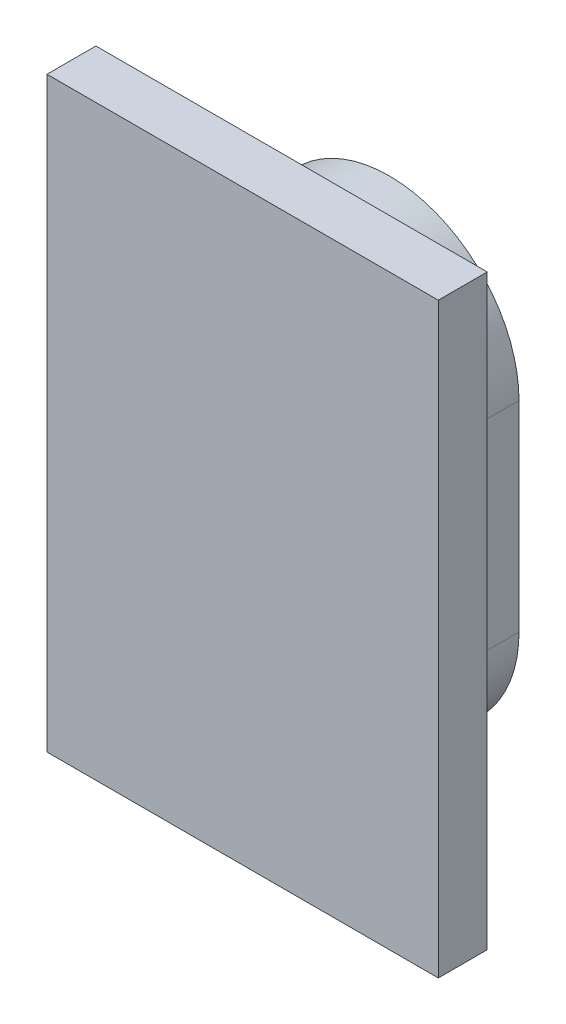
from build123d import *

# Parameters (mm, degrees)
SKETCH1_W           = 40
SKETCH1_H           = 60
BOSS_EXTRUDE1_DEPTH = 5
BOSS_EXTRUDE2_DEPTH = 10


with BuildPart() as part:
    # Sketch1 → Boss-Extrude1 (new body)
    with BuildSketch(Plane.XY):
        with Locations((0.386207951, -13.786739239)):
            Rectangle(SKETCH1_W, SKETCH1_H)
    extrude(amount=BOSS_EXTRUDE1_DEPTH)

    # Sketch4 → Boss-Extrude2 (add)
    with BuildSketch(Plane(origin=(0, 0, 0), x_dir=(-1, 0, 0), z_dir=(0, 0, -1))):
        with BuildLine():
            Line((12.863792049, -3.536739239), (12.863792049, -24.036739239))
            ThreePointArc((12.863792049, -24.036739239), (-0.386207951, -37.286739239), (-13.636207951, -24.036739239))
            Line((-13.636207951, -24.036739239), (-13.636207951, -3.536739239))
            ThreePointArc((-13.636207951, -3.536739239), (-0.386207951, 9.713260761), (12.863792049, -3.536739239))
        make_face()
        with BuildLine():
            Line((10.363792049, -3.536739239), (10.363792049, -24.036739239))
            ThreePointArc((10.363792049, -24.036739239), (-0.386207951, -34.786739239), (-11.136207951, -24.036739239))
            Line((-11.136207951, -24.036739239), (-11.136207951, -3.536739239))
            ThreePointArc((-11.136207951, -3.536739239), (-0.386207951, 7.213260761), (10.363792049, -3.536739239))
        make_face(mode=Mode.SUBTRACT)
    extrude(amount=BOSS_EXTRUDE2_DEPTH)


solid = part.part
